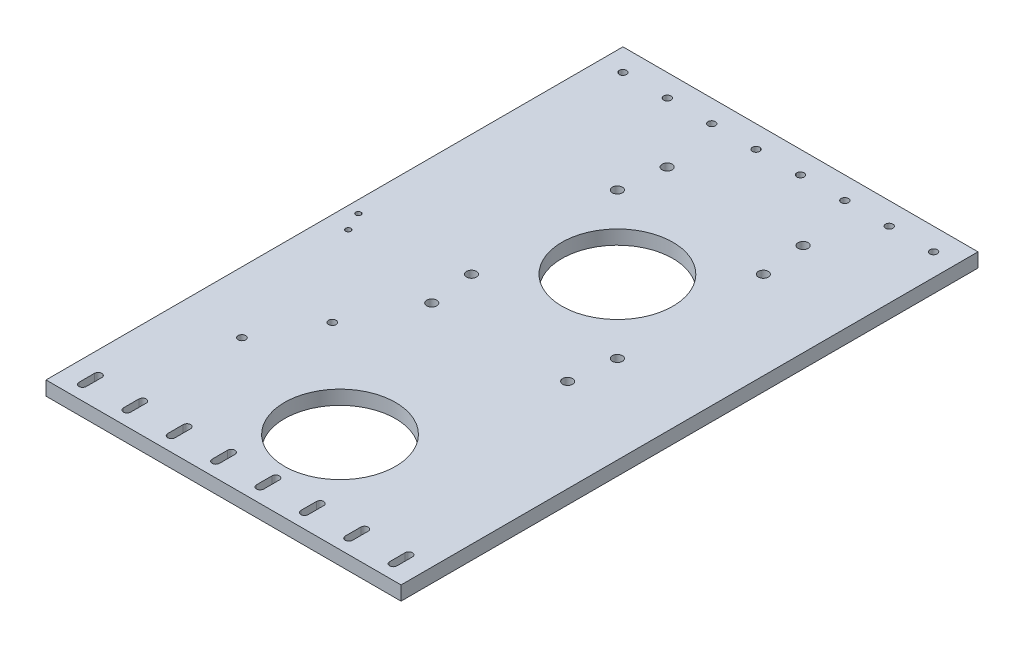
from build123d import *

# Parameters (mm, degrees)
SKETCH1_W           = 160
SKETCH1_H           = 260
SKETCH1_R           = 1.175
SKETCH1_R_2         = 2.25
SKETCH1_R_3         = 25
SKETCH1_R_4         = 1.65
BOSS_EXTRUDE1_DEPTH = 6.35
SKETCH2_R           = 1.7
CUT_EXTRUDE1_DEPTH  = 306.352783678
CUT_EXTRUDE2_REACH  = 307.353
SKETCH3_R           = 2.25


with BuildPart() as part:
    # Sketch1 → Boss-Extrude1 (new body)
    with BuildSketch(Plane(origin=(0, 0, 0), x_dir=(1, 0, 0), z_dir=(0, 1, 0))):
        with Locations((80, 130)):
            Rectangle(SKETCH1_W, SKETCH1_H)
        with BuildLine():
            ThreePointArc((11.65, 6.5), (10, 4.85), (8.35, 6.5))
            Line((8.35, 6.5), (8.35, 13.5))
            ThreePointArc((8.35, 13.5), (10, 15.15), (11.65, 13.5))
            Line((11.65, 13.5), (11.65, 6.5))
        make_face(mode=Mode.SUBTRACT)
        with BuildLine():
            Line((31.65, 13.5), (31.65, 6.5))
            ThreePointArc((31.65, 6.5), (30, 4.85), (28.35, 6.5))
            Line((28.35, 6.5), (28.35, 13.5))
            ThreePointArc((28.35, 13.5), (30, 15.15), (31.65, 13.5))
        make_face(mode=Mode.SUBTRACT)
        with BuildLine():
            Line((51.65, 13.5), (51.65, 6.5))
            ThreePointArc((51.65, 6.5), (50, 4.85), (48.35, 6.5))
            Line((48.35, 6.5), (48.35, 13.5))
            ThreePointArc((48.35, 13.5), (50, 15.15), (51.65, 13.5))
        make_face(mode=Mode.SUBTRACT)
        with BuildLine():
            Line((71.65, 13.5), (71.65, 6.5))
            ThreePointArc((71.65, 6.5), (70, 4.85), (68.35, 6.5))
            Line((68.35, 6.5), (68.35, 13.5))
            ThreePointArc((68.35, 13.5), (70, 15.15), (71.65, 13.5))
        make_face(mode=Mode.SUBTRACT)
        with Locations((9.516263037, 126.701090269)):
            Circle(SKETCH1_R, mode=Mode.SUBTRACT)
        with Locations((56.875, 116.955944018)):
            Circle(SKETCH1_R_2, mode=Mode.SUBTRACT)
        with BuildLine():
            Line((91.65, 13.5), (91.65, 6.5))
            ThreePointArc((91.65, 6.5), (90, 4.85), (88.35, 6.5))
            Line((88.35, 6.5), (88.35, 13.5))
            ThreePointArc((88.35, 13.5), (90, 15.15), (91.65, 13.5))
        make_face(mode=Mode.SUBTRACT)
        with BuildLine():
            Line((111.65, 13.5), (111.65, 6.5))
            ThreePointArc((111.65, 6.5), (110, 4.85), (108.35, 6.5))
            Line((108.35, 6.5), (108.35, 13.5))
            ThreePointArc((108.35, 13.5), (110, 15.15), (111.65, 13.5))
        make_face(mode=Mode.SUBTRACT)
        with Locations((87.5, 45)):
            Circle(SKETCH1_R_3, mode=Mode.SUBTRACT)
        with BuildLine():
            Line((131.65, 13.5), (131.65, 6.5))
            ThreePointArc((131.65, 6.5), (130, 4.85), (128.35, 6.5))
            Line((128.35, 6.5), (128.35, 13.5))
            ThreePointArc((128.35, 13.5), (130, 15.15), (131.65, 13.5))
        make_face(mode=Mode.SUBTRACT)
        with BuildLine():
            Line((151.65, 13.5), (151.65, 6.5))
            ThreePointArc((151.65, 6.5), (150, 4.85), (148.35, 6.5))
            Line((148.35, 6.5), (148.35, 13.5))
            ThreePointArc((148.35, 13.5), (150, 15.15), (151.65, 13.5))
        make_face(mode=Mode.SUBTRACT)
        with Locations((118.125, 116.955944018)):
            Circle(SKETCH1_R_2, mode=Mode.SUBTRACT)
        with Locations((5.475532842, 135.298909731)):
            Circle(SKETCH1_R, mode=Mode.SUBTRACT)
        with Locations((10, 250)):
            Circle(SKETCH1_R_4, mode=Mode.SUBTRACT)
        with Locations((30, 250)):
            Circle(SKETCH1_R_4, mode=Mode.SUBTRACT)
        with Locations((56.875, 223.044055982)):
            Circle(SKETCH1_R_2, mode=Mode.SUBTRACT)
        with Locations((50, 250)):
            Circle(SKETCH1_R_4, mode=Mode.SUBTRACT)
        with Locations((70, 250)):
            Circle(SKETCH1_R_4, mode=Mode.SUBTRACT)
        with Locations((87.5, 170)):
            Circle(SKETCH1_R_3, mode=Mode.SUBTRACT)
        with Locations((118.125, 223.044055982)):
            Circle(SKETCH1_R_2, mode=Mode.SUBTRACT)
        with Locations((90, 250)):
            Circle(SKETCH1_R_4, mode=Mode.SUBTRACT)
        with Locations((110, 250)):
            Circle(SKETCH1_R_4, mode=Mode.SUBTRACT)
        with Locations((130, 250)):
            Circle(SKETCH1_R_4, mode=Mode.SUBTRACT)
        with Locations((150, 250)):
            Circle(SKETCH1_R_4, mode=Mode.SUBTRACT)
    extrude(amount=BOSS_EXTRUDE1_DEPTH)

    # Sketch2 → Cut-Extrude1 (cut, through all)
    with BuildSketch(Plane(origin=(0, 6.35, 0), x_dir=(1, 0, 0), z_dir=(0, 1, 0))):
        with Locations((27.663890721, 60.64097268)):
            Circle(SKETCH2_R)
        with Locations((42.063890721, 86.95902732)):
            Circle(SKETCH2_R)
    extrude(amount=-CUT_EXTRUDE1_DEPTH, mode=Mode.SUBTRACT)

    # Sketch3 → Cut-Extrude2 (cut, up to next)
    with BuildSketch(Plane(origin=(0, 6.35, 0), x_dir=(1, 0, 0), z_dir=(0, 1, 0)), mode=Mode.PRIVATE) as cut_extrude2_sk1:
        with Locations((54.619534675, 202.880465325)):
            Circle(SKETCH3_R)
    cut_extrude2_tool1 = extrude(cut_extrude2_sk1.sketch, amount=-CUT_EXTRUDE2_REACH, mode=Mode.PRIVATE) & part.part
    # Sketch3 → Cut-Extrude2 (cut, up to next)
    with BuildSketch(Plane(origin=(0, 6.35, 0), x_dir=(1, 0, 0), z_dir=(0, 1, 0)), mode=Mode.PRIVATE) as cut_extrude2_sk2:
        with Locations((54.619534675, 137.119534675)):
            Circle(SKETCH3_R)
    cut_extrude2_tool2 = extrude(cut_extrude2_sk2.sketch, amount=-CUT_EXTRUDE2_REACH, mode=Mode.PRIVATE) & part.part
    # Sketch3 → Cut-Extrude2 (cut, up to next)
    with BuildSketch(Plane(origin=(0, 6.35, 0), x_dir=(1, 0, 0), z_dir=(0, 1, 0)), mode=Mode.PRIVATE) as cut_extrude2_sk3:
        with Locations((120.380465325, 137.119534675)):
            Circle(SKETCH3_R)
    cut_extrude2_tool3 = extrude(cut_extrude2_sk3.sketch, amount=-CUT_EXTRUDE2_REACH, mode=Mode.PRIVATE) & part.part
    # Sketch3 → Cut-Extrude2 (cut, up to next)
    with BuildSketch(Plane(origin=(0, 6.35, 0), x_dir=(1, 0, 0), z_dir=(0, 1, 0)), mode=Mode.PRIVATE) as cut_extrude2_sk4:
        with Locations((120.380465325, 202.880465325)):
            Circle(SKETCH3_R)
    cut_extrude2_tool4 = extrude(cut_extrude2_sk4.sketch, amount=-CUT_EXTRUDE2_REACH, mode=Mode.PRIVATE) & part.part
    add(cut_extrude2_tool1.solids().sort_by_distance((54.619535, 6.35, -202.880465))[0], mode=Mode.SUBTRACT)
    add(cut_extrude2_tool2.solids().sort_by_distance((54.619535, 6.35, -137.119535))[0], mode=Mode.SUBTRACT)
    add(cut_extrude2_tool3.solids().sort_by_distance((120.380465, 6.35, -137.119535))[0], mode=Mode.SUBTRACT)
    add(cut_extrude2_tool4.solids().sort_by_distance((120.380465, 6.35, -202.880465))[0], mode=Mode.SUBTRACT)


solid = part.part
